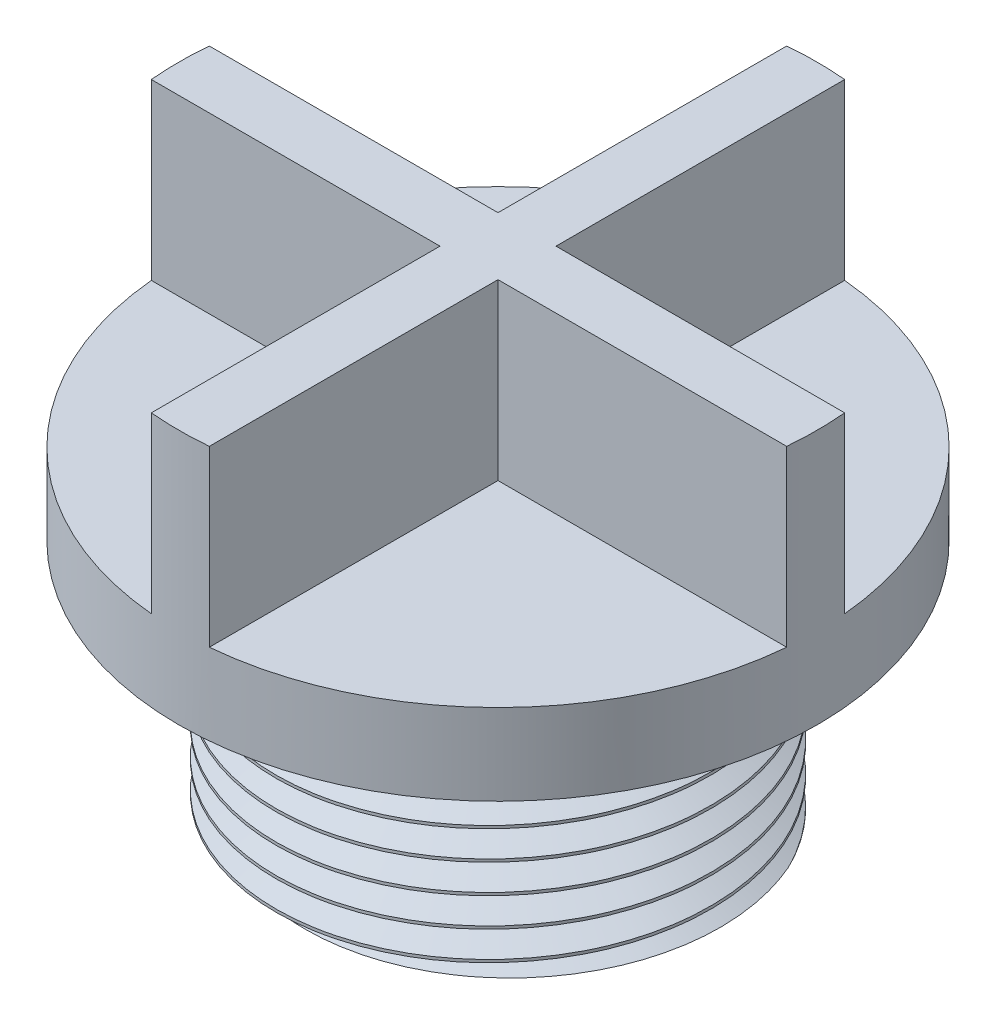
from build123d import *
from build123d.topology import SkipClean

# Parameters (mm, degrees)
SKETCH1_R           = 18.75
BOSS_EXTRUDE1_DEPTH = 20
SKETCH2_R           = 27.5
BOSS_EXTRUDE2_DEPTH = 7
BOSS_EXTRUDE3_DEPTH = 15
CUT_SWEEP1_PITCH    = 2.5


with BuildPart() as part:
    # Sketch1 → Boss-Extrude1 (new body)
    with BuildSketch(Plane(origin=(0, 0, 0), x_dir=(1, 0, 0), z_dir=(0, 1, 0))):
        with Locations(Location((0, 0, 0), (0, 0, 270))):
            Circle(SKETCH1_R)
    extrude(amount=BOSS_EXTRUDE1_DEPTH)

    # Sketch2 → Boss-Extrude2 (add)
    with BuildSketch(Plane(origin=(0, 20, 0), x_dir=(1, 0, 0), z_dir=(0, 1, 0))):
        with Locations(Location((0, 0, 0), (0, 0, 270))):
            Circle(SKETCH2_R)
    extrude(amount=BOSS_EXTRUDE2_DEPTH)

    # Sketch3 → Boss-Extrude3 (add)
    with SkipClean():  # the faces are left unmerged after this step: merging them gives an invalid solid
        with BuildSketch(Plane(origin=(0, 27, 0), x_dir=(1, 0, 0), z_dir=(0, 1, 0))):
            with BuildLine():
                Line((2.5, 2.5), (27.386127875, 2.5))
                ThreePointArc((27.386127875, 2.5), (27.5, 0), (27.386127875, -2.5))
                Line((27.386127875, -2.5), (2.5, -2.5))
                Line((2.5, -2.5), (2.5, -27.386127875))
                ThreePointArc((2.5, -27.386127875), (0, -27.5), (-2.5, -27.386127875))
                Line((-2.5, -27.386127875), (-2.5, -2.5))
                Line((-2.5, -2.5), (-27.386127875, -2.5))
                ThreePointArc((-27.386127875, -2.5), (-27.5, 0), (-27.386127875, 2.5))
                Line((-27.386127875, 2.5), (-2.5, 2.5))
                Line((-2.5, 2.5), (-2.5, 27.386127875))
                ThreePointArc((-2.5, 27.386127875), (0, 27.5), (2.5, 27.386127875))
                Line((2.5, 27.386127875), (2.5, 2.5))
            make_face()
        extrude(amount=BOSS_EXTRUDE3_DEPTH)

    # Cut-Sweep1: arcs per turn and ends read off the stored shape
    # Cut-Sweep1: the profile of Sketch5 screwed along a right-hand helix through 8.5 turns, 10 arcs to a turn; built about Z, then put on its axis
    with SkipClean():  # the faces are left unmerged after this step: merging them gives an invalid solid
        cut_sweep1_z = Axis((0, 0, 0), (0, 0, 1))
        cut_sweep1_corners = [(16.796736595, 0.000879191, -2.54143088), (18.91769462, -0.026389096, -1.256443137), (18.970298171, 0.026214455, -3.735327106)]
        with BuildLine(mode=Mode.PRIVATE) as cut_sweep1_profile:
            Line(cut_sweep1_corners[0], cut_sweep1_corners[1])
            Line(cut_sweep1_corners[1], cut_sweep1_corners[2])
            Line(cut_sweep1_corners[2], cut_sweep1_corners[0])
        cut_sweep1_cap = Face(cut_sweep1_profile.wire())
        cut_sweep1_turn_angles = [0, 18, 36, 54, 72, 90, 108, 126, 144, 162, 180, 198, 216, 234, 252, 270, 288, 306, 324, 342, 360]
        cut_sweep1_turn_weights = [1, 0.9510565162951535, 1, 0.9510565162951535, 1, 0.9510565162951535, 1, 0.9510565162951535, 1, 0.9510565162951535, 1, 0.9510565162951535, 1, 0.9510565162951535, 1, 0.9510565162951535, 1, 0.9510565162951535, 1, 0.9510565162951535, 1]
        cut_sweep1_turn_rails = [Edge.make_bspline([Vector(p[0], p[1], 0).rotate(cut_sweep1_z, cut_sweep1_turn_angles[k]) / cut_sweep1_turn_weights[k] + Vector(0, 0, p[2] + CUT_SWEEP1_PITCH * cut_sweep1_turn_angles[k] / 360) for k in range(21)], [0, 0, 0, 1, 1, 2, 2, 3, 3, 4, 4, 5, 5, 6, 6, 7, 7, 8, 8, 9, 9, 10, 10, 10], 2, cut_sweep1_turn_weights) for p in cut_sweep1_corners]
        cut_sweep1_turn_sides = [Face.make_surface_from_curves(cut_sweep1_turn_rails[p[0]], cut_sweep1_turn_rails[p[1]]) for p in [(0, 1), (1, 2), (2, 0)]]
        cut_sweep1_last_angles = [2880, 2898, 2916, 2934, 2952, 2970, 2988, 3006, 3024, 3042, 3060]
        cut_sweep1_last_weights = [1, 0.9510565162951535, 1, 0.9510565162951535, 1, 0.9510565162951535, 1, 0.9510565162951535, 1, 0.9510565162951535, 1]
        cut_sweep1_last_rails = [Edge.make_bspline([Vector(p[0], p[1], 0).rotate(cut_sweep1_z, cut_sweep1_last_angles[k]) / cut_sweep1_last_weights[k] + Vector(0, 0, p[2] + CUT_SWEEP1_PITCH * cut_sweep1_last_angles[k] / 360) for k in range(11)], [0, 0, 0, 1, 1, 2, 2, 3, 3, 4, 4, 5, 5, 5], 2, cut_sweep1_last_weights) for p in cut_sweep1_corners]
        cut_sweep1_last_sides = [Face.make_surface_from_curves(cut_sweep1_last_rails[p[0]], cut_sweep1_last_rails[p[1]]) for p in [(0, 1), (1, 2), (2, 0)]]
        cut_sweep1 = Plane(origin=(0, 0, 0), x_dir=(-0.7071067811865537, 0, 0.7071067811865414), z_dir=(0, 1, 0)) * Solid(Shell([*[p.moved(Location((0, 0, CUT_SWEEP1_PITCH * i))) for i in range(8) for p in cut_sweep1_turn_sides], *cut_sweep1_last_sides, cut_sweep1_cap, cut_sweep1_cap.rotate(cut_sweep1_z, 3060).moved(Location((0, 0, CUT_SWEEP1_PITCH * 3060 / 360)))]))
        add(cut_sweep1, mode=Mode.SUBTRACT)


solid = part.part
